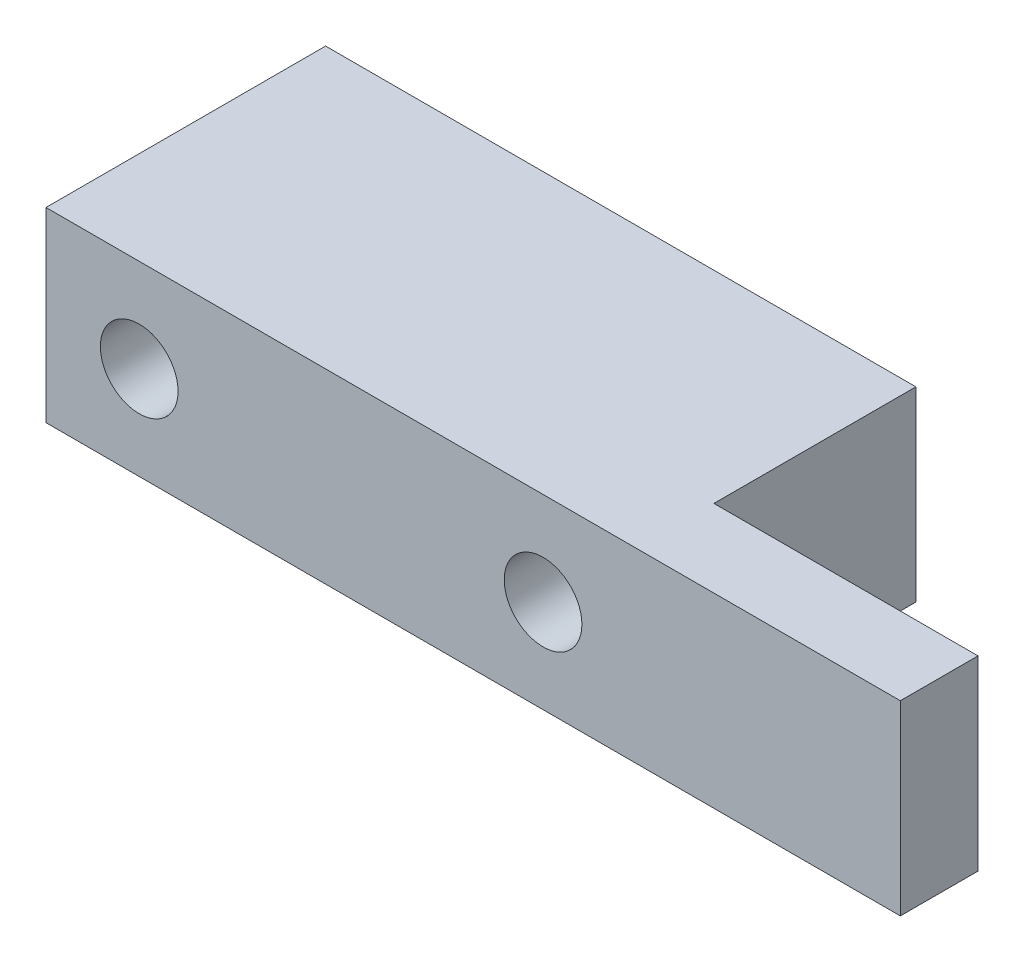
from build123d import *

# Parameters (mm, degrees)
SKETCH1_W           = 6
SKETCH1_H           = 19
SKETCH1_R           = 1.25
BOSS_EXTRUDE1_DEPTH = 9
SKETCH2_W           = 6
SKETCH2_H           = 2.5
BOSS_EXTRUDE2_DEPTH = 8.5


with BuildPart() as part:
    # Sketch1 → Boss-Extrude1 (new body)
    with BuildSketch(Plane(origin=(0, 0, 0), x_dir=(0, 1, 0), z_dir=(0, 0, 1))):
        Rectangle(SKETCH1_W, SKETCH1_H)
        with Locations((0, 6.5)):
            Circle(SKETCH1_R, mode=Mode.SUBTRACT)
        with Locations((0, -6.5)):
            Circle(SKETCH1_R, mode=Mode.SUBTRACT)
    extrude(amount=BOSS_EXTRUDE1_DEPTH)

    # Sketch2 → Boss-Extrude2 (add)
    with BuildSketch(Plane.YZ.offset(9.5)):
        with Locations((0, 7.75)):
            Rectangle(SKETCH2_W, SKETCH2_H)
    extrude(amount=BOSS_EXTRUDE2_DEPTH)


solid = part.part
